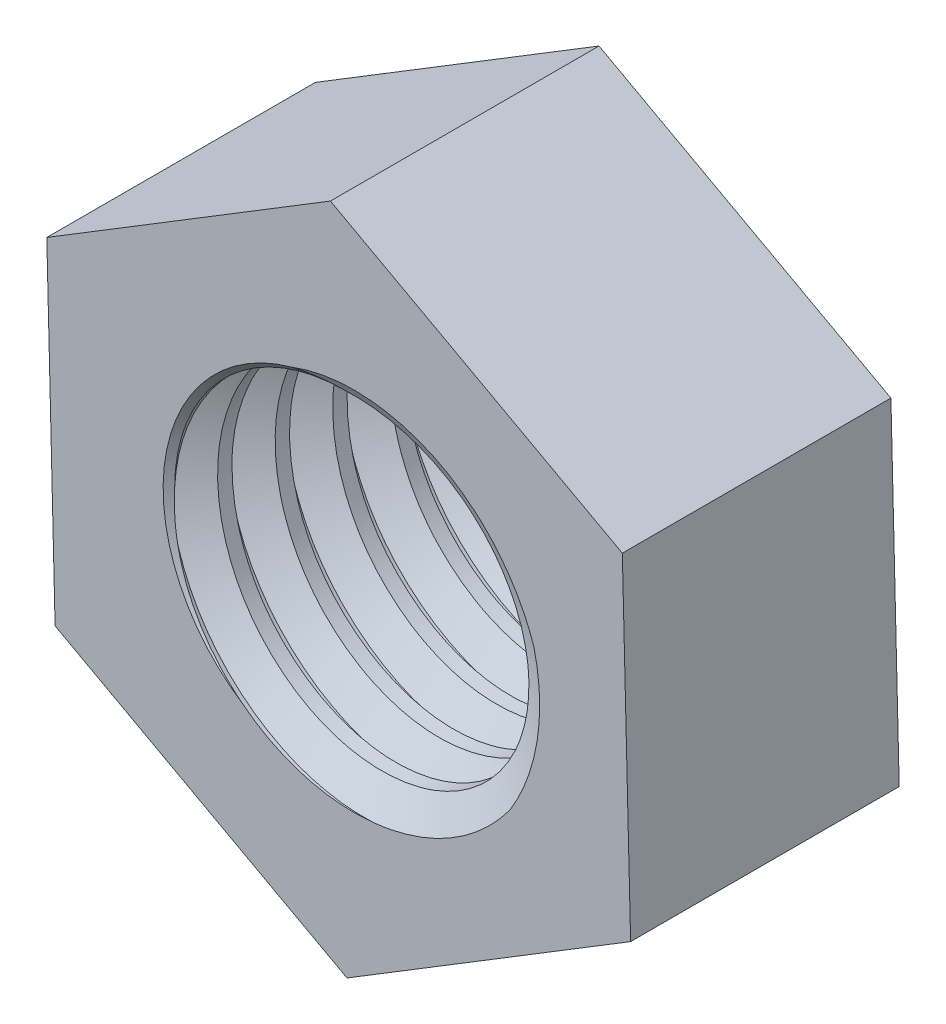
from build123d import *

# Parameters (mm, degrees)
SKETCH1_R           = 2.95
BOSS_EXTRUDE1_DEPTH = 4.665340044
CHAMFER2_SIZE       = 0.1
CHAMFER3_SIZE       = 0.1
THREAD3_PITCH       = 1


with BuildPart() as part:
    # Sketch1 → Boss-Extrude1 (new body)
    with BuildSketch(Plane.XY):
        Polygon((4.926473616, 3.010513419), (-0.143944292, 5.771708012), (-5.070417907, 2.761194592), (-4.926473616, -3.010513419), (0.143944292, -5.771708012), (5.070417907, -2.761194592), align=None)
        Circle(SKETCH1_R, mode=Mode.SUBTRACT)
    extrude(amount=BOSS_EXTRUDE1_DEPTH)

    # Chamfer2
    chamfer2_edges = [part.edges().sort_by_distance(p)[0] for p in [
        (-2.95, 0, 0),
    ]]
    chamfer(chamfer2_edges, length=CHAMFER2_SIZE)

    # Chamfer3
    chamfer3_edges = [part.edges().sort_by_distance(p)[0] for p in [
        (-2.95, 0, 4.665340044),
    ]]
    chamfer(chamfer3_edges, length=CHAMFER3_SIZE)

    # Thread3: the profile of Thread Profile3 profile screwed along a right-hand helix of 10 turns, 8 arcs to a turn; built about Z, then put on its axis
    thread3_z = Axis((0, 0, 0), (0, 0, 1))
    thread3_corners = [(2.9497, 0, -0.000173205), (3.491265875, 0, 0.312499999), (3.491265875, 0, 0.437499999), (2.9497, 0, 0.750173202)]
    with BuildLine(mode=Mode.PRIVATE) as thread3_profile:
        Line(thread3_corners[0], thread3_corners[1])
        Line(thread3_corners[1], thread3_corners[2])
        Line(thread3_corners[2], thread3_corners[3])
        Line(thread3_corners[3], thread3_corners[0])
    thread3_cap = Face(thread3_profile.wire())
    thread3_turn_angles = [0, 22.5, 45, 67.5, 90, 112.5, 135, 157.5, 180, 202.5, 225, 247.5, 270, 292.5, 315, 337.5, 360]
    thread3_turn_weights = [1, 0.9238795325112867, 1, 0.9238795325112867, 1, 0.9238795325112867, 1, 0.9238795325112867, 1, 0.9238795325112867, 1, 0.9238795325112867, 1, 0.9238795325112867, 1, 0.9238795325112867, 1]
    thread3_turn_rails = [Edge.make_bspline([Vector(p[0], p[1], 0).rotate(thread3_z, thread3_turn_angles[k]) / thread3_turn_weights[k] + Vector(0, 0, p[2] + THREAD3_PITCH * thread3_turn_angles[k] / 360) for k in range(17)], [0, 0, 0, 1, 1, 2, 2, 3, 3, 4, 4, 5, 5, 6, 6, 7, 7, 8, 8, 8], 2, thread3_turn_weights) for p in thread3_corners]
    thread3_turn_sides = [Face.make_surface_from_curves(thread3_turn_rails[p[0]], thread3_turn_rails[p[1]]) for p in [(0, 1), (1, 2), (2, 3), (3, 0)]]
    thread3 = Plane(origin=(0, 0, 7.565340044), x_dir=(-1, 0, 0), z_dir=(0, 0, -1)) * Solid(Shell([*[p.moved(Location((0, 0, THREAD3_PITCH * i))) for i in range(10) for p in thread3_turn_sides], thread3_cap, thread3_cap.rotate(thread3_z, 3600).moved(Location((0, 0, THREAD3_PITCH * 3600 / 360)))]))
    add(thread3, mode=Mode.SUBTRACT)


solid = part.part
